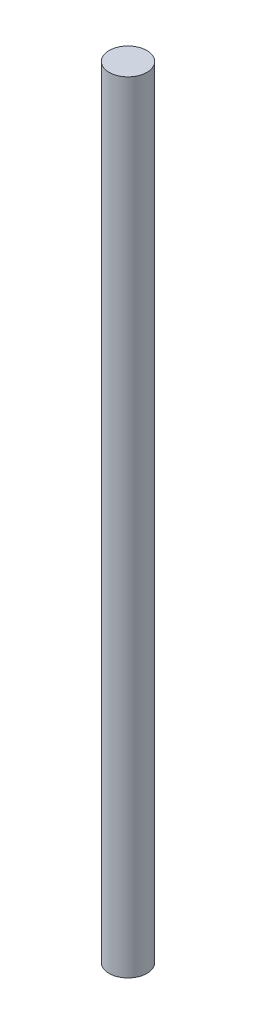
from build123d import *

# Parameters (mm, degrees)
SZKIC1_R                    = 6
DODANIE_WYCI_GNI_CIE1_DEPTH = 247.55


with BuildPart() as part:
    # Szkic1 → Dodanie-wyciągnięcie1 (new body)
    with BuildSketch(Plane(origin=(0, 0, 0), x_dir=(1, 0, 0), z_dir=(0, 1, 0))):
        Circle(SZKIC1_R)
    extrude(amount=DODANIE_WYCI_GNI_CIE1_DEPTH)


solid = part.part
